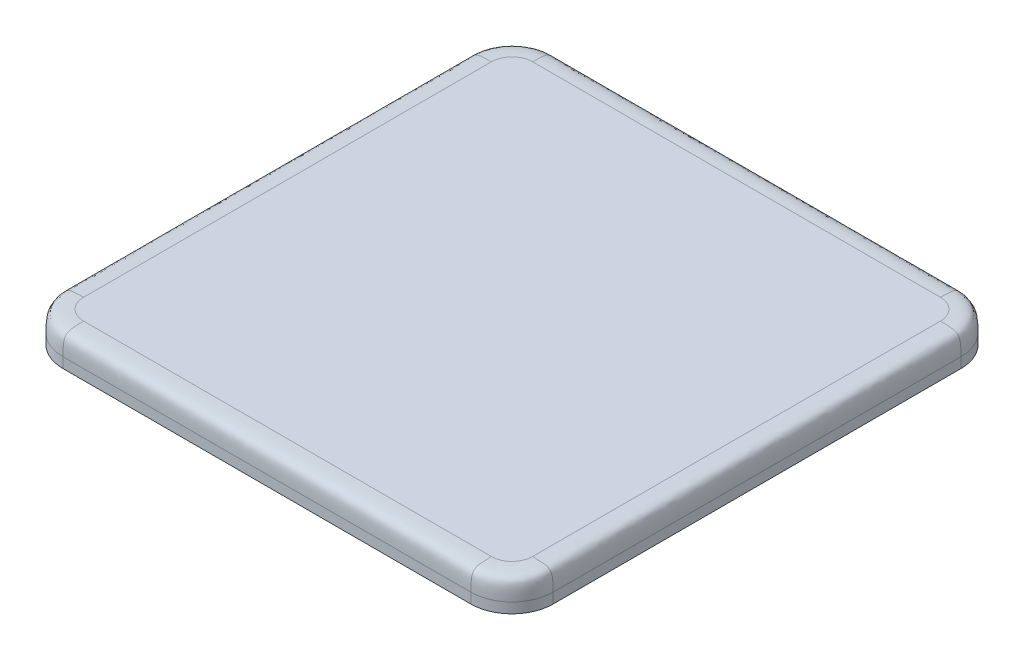
from build123d import *

# Parameters (mm, degrees)
SKETCH1_W           = 15.1257
SKETCH1_H           = 0.9525
BOSS_EXTRUDE1_DEPTH = 15.1257
FILLET3_R           = 1.27
FILLET1_SIZE        = 0.635


with BuildPart() as part:
    # Sketch1 → Boss-Extrude1 (new body)
    with BuildSketch(Plane.XY):
        with Locations((0, 0.47625)):
            Rectangle(SKETCH1_W, SKETCH1_H)
    extrude(amount=BOSS_EXTRUDE1_DEPTH)

    # Fillet3
    fillet3_edges = [part.edges().sort_by_distance(p)[0] for p in [
        (7.56285, 0.47625, 15.1257),
        (-7.56285, 0.47625, 15.1257),
        (7.56285, 0.47625, 0),
        (-7.56285, 0.47625, 0),
    ]]
    fillet(fillet3_edges, radius=FILLET3_R)

    # Fillet1
    # a fillet whose section is not a circle: 0.635 mm, written as the material it takes off along each edge
    with BuildSketch(Plane(origin=(7.56285, 0.9525, 1.27), x_dir=(0, -1, 0), z_dir=(0, 0, 1)), Plane(origin=(6.29285, 0.9525, 15.1257), x_dir=(0, -1, 0), z_dir=(-1, 0, 0))) as fillet1_piece_1:
        with BuildLine():
            Bezier((FILLET1_SIZE, 0), (0, 0), (0, -FILLET1_SIZE), weights=[1, 2.333333333, 1])
            Line((0, -FILLET1_SIZE), (-FILLET1_SIZE * 0.02, -FILLET1_SIZE))
            Line((-FILLET1_SIZE * 0.02, -FILLET1_SIZE), (-FILLET1_SIZE * 0.02, FILLET1_SIZE * 0.02))
            Line((-FILLET1_SIZE * 0.02, FILLET1_SIZE * 0.02), (FILLET1_SIZE, FILLET1_SIZE * 0.02))
            Line((FILLET1_SIZE, FILLET1_SIZE * 0.02), (FILLET1_SIZE, 0))
        make_face()
    extrude(amount=12.5857, mode=Mode.SUBTRACT)
    with BuildSketch(Plane(origin=(-7.56285, 0.9525, 1.27), x_dir=(0, -1, 0), z_dir=(0, 0, 1)), Plane(origin=(6.29285, 0.9525, 0), x_dir=(0, -1, 0), z_dir=(-1, 0, 0))) as fillet1_piece_2:
        with BuildLine():
            Bezier((FILLET1_SIZE, 0), (0, 0), (0, FILLET1_SIZE), weights=[1, 2.333333333, 1])
            Line((0, FILLET1_SIZE), (-FILLET1_SIZE * 0.02, FILLET1_SIZE))
            Line((-FILLET1_SIZE * 0.02, FILLET1_SIZE), (-FILLET1_SIZE * 0.02, -FILLET1_SIZE * 0.02))
            Line((-FILLET1_SIZE * 0.02, -FILLET1_SIZE * 0.02), (FILLET1_SIZE, -FILLET1_SIZE * 0.02))
            Line((FILLET1_SIZE, -FILLET1_SIZE * 0.02), (FILLET1_SIZE, 0))
        make_face()
    extrude(amount=12.5857, mode=Mode.SUBTRACT)
    with BuildSketch(Plane(origin=(6.29285, 0.9525, 1.27), x_dir=(1, 0, 0), z_dir=(0, 0, 1))) as fillet1_piece_3:
        with BuildLine():
            Bezier((1.27, -FILLET1_SIZE), (1.27, 0), (1.27 - FILLET1_SIZE, 0), weights=[1, 2.333333333, 1])
            Line((1.27 - FILLET1_SIZE, 0), (1.27 - FILLET1_SIZE, FILLET1_SIZE * 0.02))
            Line((1.27 - FILLET1_SIZE, FILLET1_SIZE * 0.02), (1.27 + FILLET1_SIZE * 0.02, FILLET1_SIZE * 0.02))
            Line((1.27 + FILLET1_SIZE * 0.02, FILLET1_SIZE * 0.02), (1.27 + FILLET1_SIZE * 0.02, -FILLET1_SIZE))
            Line((1.27 + FILLET1_SIZE * 0.02, -FILLET1_SIZE), (1.27, -FILLET1_SIZE))
        make_face()
    revolve(axis=Axis((6.29285, 0.9525, 1.27), (0, 1, 0)), revolution_arc=90, mode=Mode.SUBTRACT)
    with BuildSketch(Plane(origin=(6.29285, 0.9525, 13.8557), x_dir=(1, 0, 0), z_dir=(0, 0, -1))) as fillet1_piece_4:
        with BuildLine():
            Bezier((1.27, FILLET1_SIZE), (1.27, 0), (1.27 - FILLET1_SIZE, 0), weights=[1, 2.333333333, 1])
            Line((1.27 - FILLET1_SIZE, 0), (1.27 - FILLET1_SIZE, -FILLET1_SIZE * 0.02))
            Line((1.27 - FILLET1_SIZE, -FILLET1_SIZE * 0.02), (1.27 + FILLET1_SIZE * 0.02, -FILLET1_SIZE * 0.02))
            Line((1.27 + FILLET1_SIZE * 0.02, -FILLET1_SIZE * 0.02), (1.27 + FILLET1_SIZE * 0.02, FILLET1_SIZE))
            Line((1.27 + FILLET1_SIZE * 0.02, FILLET1_SIZE), (1.27, FILLET1_SIZE))
        make_face()
    revolve(axis=Axis((6.29285, 0.9525, 13.8557), (0, -1, 0)), revolution_arc=90, mode=Mode.SUBTRACT)
    with BuildSketch(Plane(origin=(-6.29285, 0.9525, 13.8557), x_dir=(-1, 0, 0), z_dir=(0, 0, -1))) as fillet1_piece_5:
        with BuildLine():
            Bezier((1.27, -FILLET1_SIZE), (1.27, 0), (1.27 - FILLET1_SIZE, 0), weights=[1, 2.333333333, 1])
            Line((1.27 - FILLET1_SIZE, 0), (1.27 - FILLET1_SIZE, FILLET1_SIZE * 0.02))
            Line((1.27 - FILLET1_SIZE, FILLET1_SIZE * 0.02), (1.27 + FILLET1_SIZE * 0.02, FILLET1_SIZE * 0.02))
            Line((1.27 + FILLET1_SIZE * 0.02, FILLET1_SIZE * 0.02), (1.27 + FILLET1_SIZE * 0.02, -FILLET1_SIZE))
            Line((1.27 + FILLET1_SIZE * 0.02, -FILLET1_SIZE), (1.27, -FILLET1_SIZE))
        make_face()
    revolve(axis=Axis((-6.29285, 0.9525, 13.8557), (0, 1, 0)), revolution_arc=90, mode=Mode.SUBTRACT)
    with BuildSketch(Plane(origin=(-6.29285, 0.9525, 1.27), x_dir=(-1, 0, 0), z_dir=(0, 0, 1))) as fillet1_piece_6:
        with BuildLine():
            Bezier((1.27, FILLET1_SIZE), (1.27, 0), (1.27 - FILLET1_SIZE, 0), weights=[1, 2.333333333, 1])
            Line((1.27 - FILLET1_SIZE, 0), (1.27 - FILLET1_SIZE, -FILLET1_SIZE * 0.02))
            Line((1.27 - FILLET1_SIZE, -FILLET1_SIZE * 0.02), (1.27 + FILLET1_SIZE * 0.02, -FILLET1_SIZE * 0.02))
            Line((1.27 + FILLET1_SIZE * 0.02, -FILLET1_SIZE * 0.02), (1.27 + FILLET1_SIZE * 0.02, FILLET1_SIZE))
            Line((1.27 + FILLET1_SIZE * 0.02, FILLET1_SIZE), (1.27, FILLET1_SIZE))
        make_face()
    revolve(axis=Axis((-6.29285, 0.9525, 1.27), (0, -1, 0)), revolution_arc=90, mode=Mode.SUBTRACT)


solid = part.part
